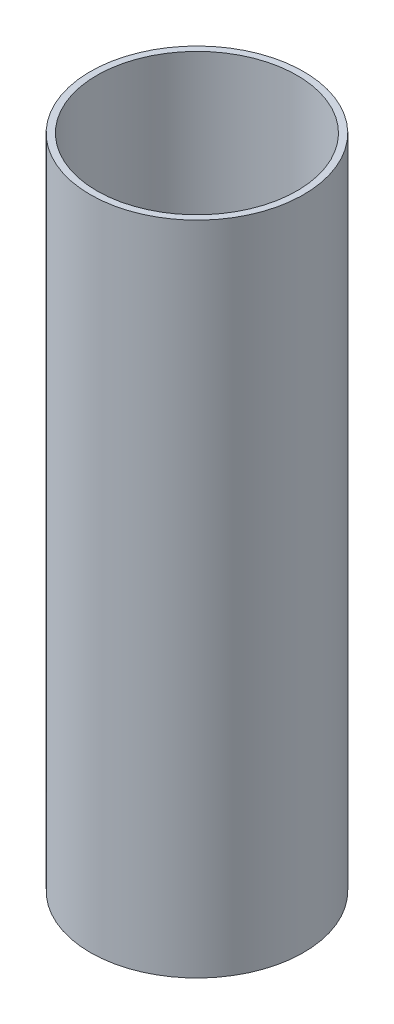
from build123d import *

# Parameters (mm, degrees)
SKETCH1_R           = 32.5
SKETCH1_R_2         = 30.5
BOSS_EXTRUDE1_DEPTH = 200


with BuildPart() as part:
    # Sketch1 → Boss-Extrude1 (new body)
    with BuildSketch(Plane(origin=(0, 0, 0), x_dir=(1, 0, 0), z_dir=(0, 1, 0))):
        Circle(SKETCH1_R)
        Circle(SKETCH1_R_2, mode=Mode.SUBTRACT)
    extrude(amount=BOSS_EXTRUDE1_DEPTH)


solid = part.part
